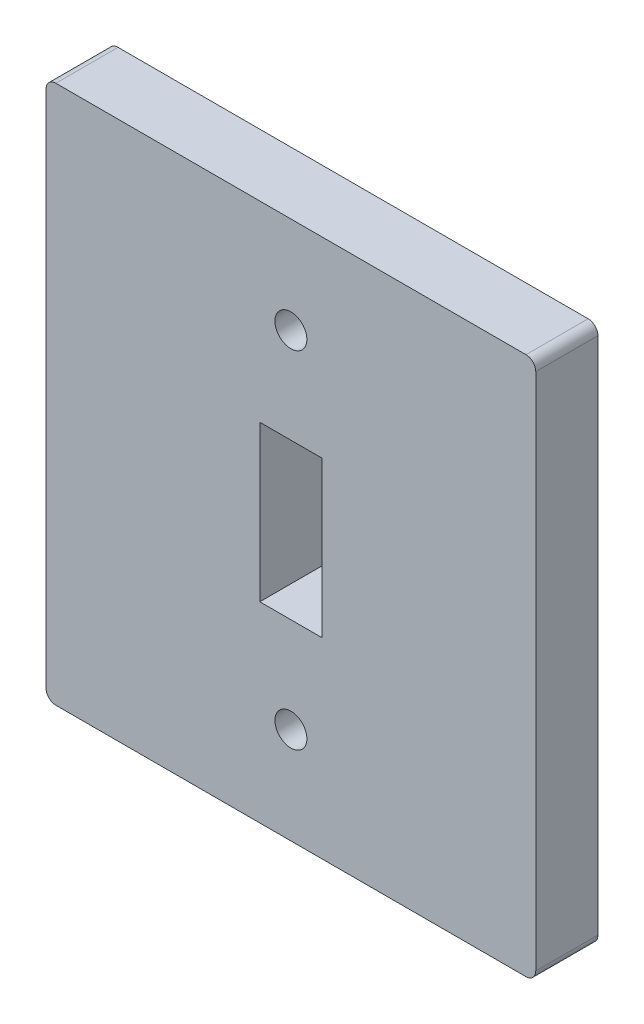
from build123d import *

# Parameters (mm, degrees)
SKETCH1_W                                        = 100
SKETCH1_H                                        = 110
BOSS_EXTRUDE2_DEPTH                              = 12.7
CSK_FOR_1_4_FLAT_HEAD_MACHINE_SCREW3_D           = 6.5278
CSK_FOR_1_4_FLAT_HEAD_MACHINE_SCREW3_CSINK_D     = 12.8778
CSK_FOR_1_4_FLAT_HEAD_MACHINE_SCREW3_CSINK_ANGLE = 82
CSK_FOR_1_4_FLAT_HEAD_MACHINE_SCREW4_D           = 6.5278
CSK_FOR_1_4_FLAT_HEAD_MACHINE_SCREW4_CSINK_D     = 12.8778
CSK_FOR_1_4_FLAT_HEAD_MACHINE_SCREW4_CSINK_ANGLE = 82
FILLET1_R                                        = 2


with BuildPart() as part:
    # Sketch1 → Boss-Extrude2 (new body)
    with BuildSketch(Plane.XY):
        with Locations((50, -55)):
            Rectangle(SKETCH1_W, SKETCH1_H)
        Polygon((50, -39.125), (56.35, -39.125), (56.35, -55), (56.35, -70.875), (50, -70.875), (43.65, -70.875), (43.65, -39.125), align=None, mode=Mode.SUBTRACT)
    extrude(amount=BOSS_EXTRUDE2_DEPTH)

    # CSK for 1/4 Flat Head Machine Screw3 (through all)
    with Locations(Plane(origin=(0, 0, 0), x_dir=(-1, 0, 0), z_dir=(0, 0, -1))):
        with Locations((-50, -90.31)):
            CounterSinkHole(CSK_FOR_1_4_FLAT_HEAD_MACHINE_SCREW3_D / 2, CSK_FOR_1_4_FLAT_HEAD_MACHINE_SCREW3_CSINK_D / 2, counter_sink_angle=CSK_FOR_1_4_FLAT_HEAD_MACHINE_SCREW3_CSINK_ANGLE)

    # CSK for 1/4 Flat Head Machine Screw4 (through all)
    with Locations(Plane(origin=(0, 0, 0), x_dir=(-1, 0, 0), z_dir=(0, 0, -1))):
        with Locations((-50, -19.69)):
            CounterSinkHole(CSK_FOR_1_4_FLAT_HEAD_MACHINE_SCREW4_D / 2, CSK_FOR_1_4_FLAT_HEAD_MACHINE_SCREW4_CSINK_D / 2, counter_sink_angle=CSK_FOR_1_4_FLAT_HEAD_MACHINE_SCREW4_CSINK_ANGLE)

    # Fillet1
    fillet1_edges = [part.edges().sort_by_distance(p)[0] for p in [
        (0, 0, 6.35),
        (100, 0, 6.35),
        (0, -110, 6.35),
        (100, -110, 6.35),
    ]]
    fillet(fillet1_edges, radius=FILLET1_R)


solid = part.part
